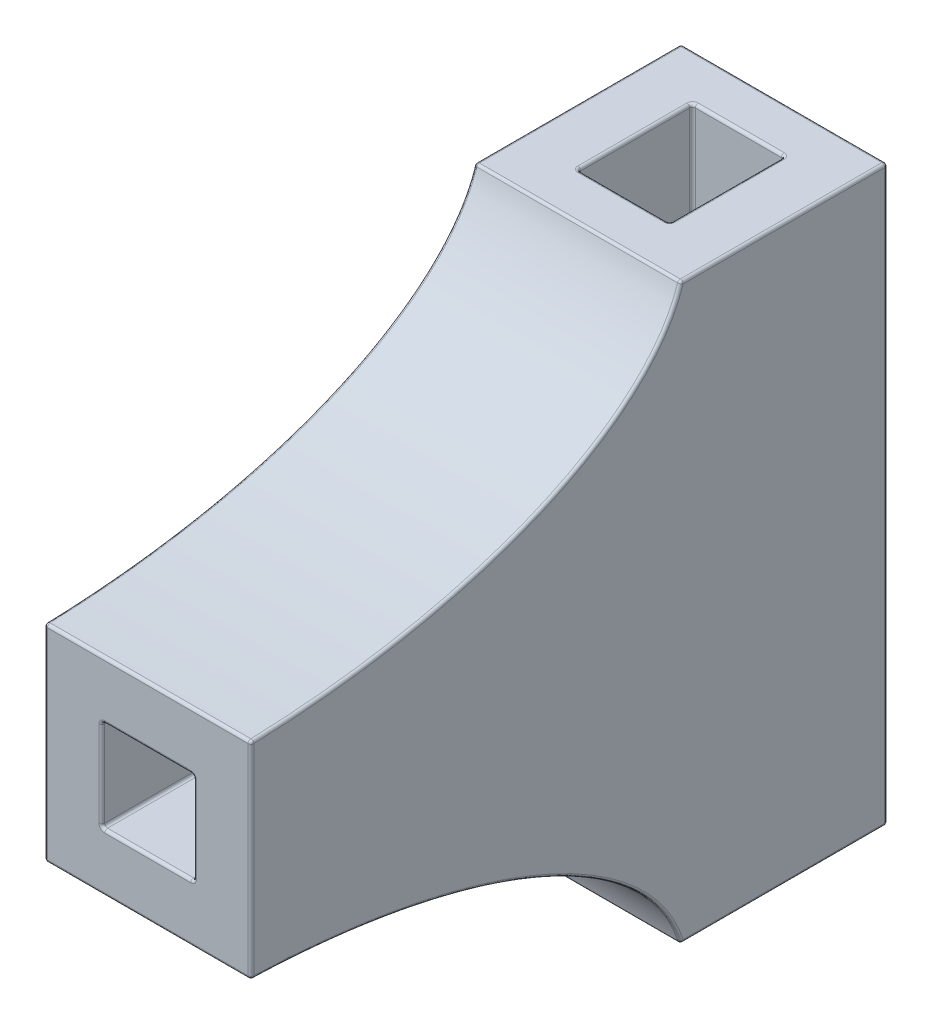
from build123d import *

# Parameters (mm, degrees)
ESQUISSE1_W             = 7.2
ESQUISSE1_H             = 7.2
ESQUISSE1_W_2           = 3.2
ESQUISSE1_H_2           = 4
BOSS_EXTRU_1_DEPTH      = 20
ESQUISSE2_W             = 7.2
ESQUISSE2_H             = 7.2
ESQUISSE2_W_2           = 3.2
ESQUISSE2_H_2           = 3.2
BOSS_EXTRU_2_DEPTH      = 15
ENL_V_MAT_EXTRU_1_REACH = 27.258
ESQUISSE3_W             = 3.2
ESQUISSE3_H             = 3.2
CONG_9_START            = -3.6
CONG_9_DEPTH            = 7.2
CONG_10_R               = 0.1


with BuildPart() as part:
    # Esquisse1 → Boss.-Extru.1 (new body)
    with BuildSketch(Plane(origin=(0, 0, 0), x_dir=(1, 0, 0), z_dir=(0, 1, 0))):
        Rectangle(ESQUISSE1_W, ESQUISSE1_H)
        Rectangle(ESQUISSE1_W_2, ESQUISSE1_H_2, mode=Mode.SUBTRACT)
    extrude(amount=BOSS_EXTRU_1_DEPTH)

    # Esquisse2 → Boss.-Extru.2 (add)
    with BuildSketch(Plane.XY.offset(3.6)):
        with Locations((0, 10)):
            Rectangle(ESQUISSE2_W, ESQUISSE2_H)
        with Locations((0, 10)):
            Rectangle(ESQUISSE2_W_2, ESQUISSE2_H_2, mode=Mode.SUBTRACT)
    extrude(amount=BOSS_EXTRU_2_DEPTH)

    # Esquisse3 → Enlèv. mat.-Extru.1 (cut, up to next)
    with BuildSketch(Plane.XY.offset(3.6), mode=Mode.PRIVATE) as enl_v_mat_extru_1_sk1:
        with Locations((0, 10)):
            Rectangle(ESQUISSE3_W, ESQUISSE3_H)
    enl_v_mat_extru_1_tool1 = extrude(enl_v_mat_extru_1_sk1.sketch, amount=-ENL_V_MAT_EXTRU_1_REACH, mode=Mode.PRIVATE) & part.part
    add(enl_v_mat_extru_1_tool1.solids().sort_by_distance((0, 10, 3.6))[0], mode=Mode.SUBTRACT)

    # Congé9: read off the stored shape, not the designer's step
    # Congé9 outline → Congé9 (add)
    with BuildSketch(Plane.YZ.offset(CONG_9_START)):
        with BuildLine():
            Line((13.6, 3.6), (20, 3.6))
            add(Edge.make_bspline(
                [(20, 3.6), (13.991251414, 5.401600603), (13.6, 18.6)],
                knots=[0, 0, 0, 1, 1, 1], degree=2, weights=[1, 0.811003867, 1]))
            Line((13.6, 18.6), (13.6, 3.6))
        make_face()
        with BuildLine():
            add(Edge.make_bspline(
                [(0, 3.6), (6.008748586, 5.401600603), (6.4, 18.6)],
                knots=[0, 0, 0, 1, 1, 1], degree=2, weights=[1, 0.811003867, 1]))
            Line((0, 3.6), (6.4, 3.6))
            Line((6.4, 3.6), (6.4, 18.6))
        make_face()
    extrude(amount=CONG_9_DEPTH)

    # Congé10
    cong_10_edges = [part.edges().sort_by_distance(p)[0] for p in [
        (0, 20, -3.6),
        (1.6, 0, 0),
        (1.6, 15.8, 2),
        (0, 0, -2),
        (1.6, 10, -2),
        (-1.6, 0, 0),
        (-1.6, 10, -2),
        (0, 0, 2),
        (-1.6, 15.8, 2),
        (1.6, 20, 0),
        (-3.6, 20, 0),
        (0, 20, -2),
        (-1.6, 20, 0),
        (0, 20, 2),
        (-3.6, 10, 18.6),
        (0, 6.4, 18.6),
        (3.6, 10, 18.6),
        (0, 13.6, 18.6),
        (1.6, 10, 18.6),
        (1.6, 11.6, 10.3),
        (0, 11.6, 18.6),
        (-1.6, 11.6, 10.3),
        (-1.6, 10, 18.6),
        (-1.6, 8.4, 10.3),
        (0, 8.4, 18.6),
        (1.6, 8.4, 10.3),
        (0, 20, 3.6),
        (-3.6, 0, 0),
        (0, 0, -3.6),
        (-1.6, 4.2, 2),
        (1.6, 4.2, 2),
        (3.6, 0, 0),
        (0, 8.4, 2),
        (0, 11.6, 2),
        (0, 0, 3.6),
        (-3.6, 14.943900968, 10.153204545),
        (3.6, 14.943900968, 10.153204545),
        (3.6, 5.056099032, 10.153204545),
        (-3.6, 5.056099032, 10.153204545),
        (-3.6, 10, -3.6),
        (3.6, 10, -3.6),
        (3.6, 20, 0),
    ]]
    fillet(cong_10_edges, radius=CONG_10_R)


solid = part.part
